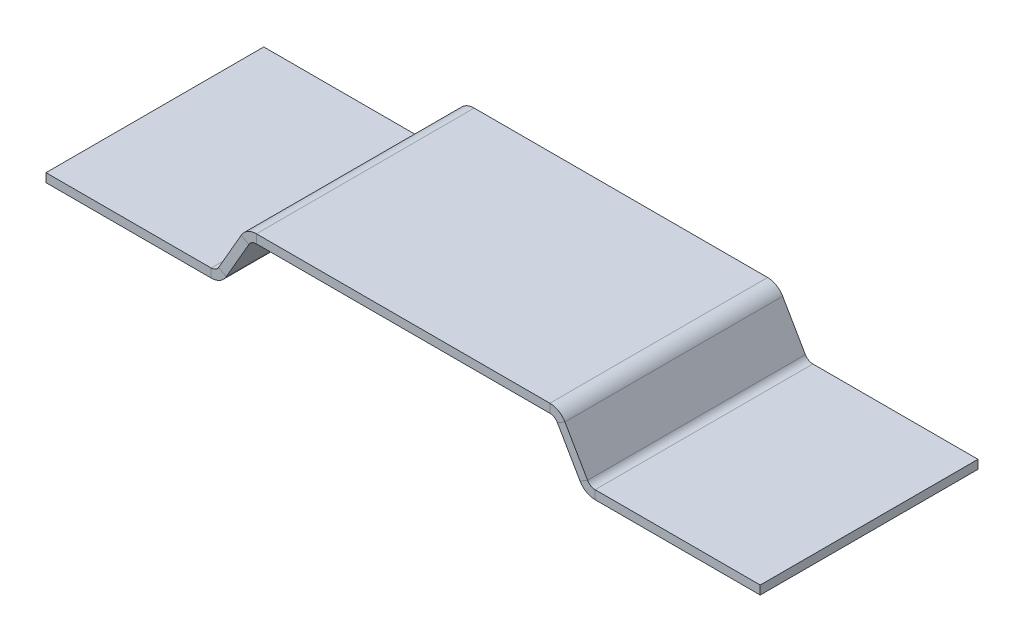
from build123d import *

# Parameters (mm, degrees)
SM_BASE_FLANGE_1_DEPTH = 125


# Sheet-metal steps are written as plain solids
with BuildPart() as part:
    # Sketch 1 → 基体-法兰1 (new, symmetric)
    with BuildSketch(Plane.XY):
        with BuildLine():
            Line((-410, 0), (-220.414518843, 0))
            ThreePointArc((-220.414518843, 0), (-215.414518843, 1.339745962), (-211.754264805, 5))
            Line((-211.754264805, 5), (-185.773502692, 50))
            ThreePointArc((-185.773502692, 50), (-178.452994616, 57.320508076), (-168.452994616, 60))
            Line((-168.452994616, 60), (168.452994616, 60))
            ThreePointArc((168.452994616, 60), (178.452994616, 57.320508076), (185.773502692, 50))
            Line((185.773502692, 50), (211.754264805, 5))
            ThreePointArc((211.754264805, 5), (215.414518843, 1.339745962), (220.414518843, 0))
            Line((220.414518843, 0), (410, 0))
            Line((410, 0), (410, -10))
            Line((410, -10), (220.414518843, -10))
            ThreePointArc((220.414518843, -10), (210.414518843, -7.320508076), (203.094010768, 0))
            Line((203.094010768, 0), (177.113248654, 45))
            ThreePointArc((177.113248654, 45), (173.452994616, 48.660254038), (168.452994616, 50))
            Line((168.452994616, 50), (-168.452994616, 50))
            ThreePointArc((-168.452994616, 50), (-173.452994616, 48.660254038), (-177.113248654, 45))
            Line((-177.113248654, 45), (-203.094010768, 0))
            ThreePointArc((-203.094010768, 0), (-210.414518843, -7.320508076), (-220.414518843, -10))
            Line((-220.414518843, -10), (-410, -10))
            Line((-410, -10), (-410, 0))
        make_face()
    extrude(amount=SM_BASE_FLANGE_1_DEPTH, both=True)


solid = part.part
